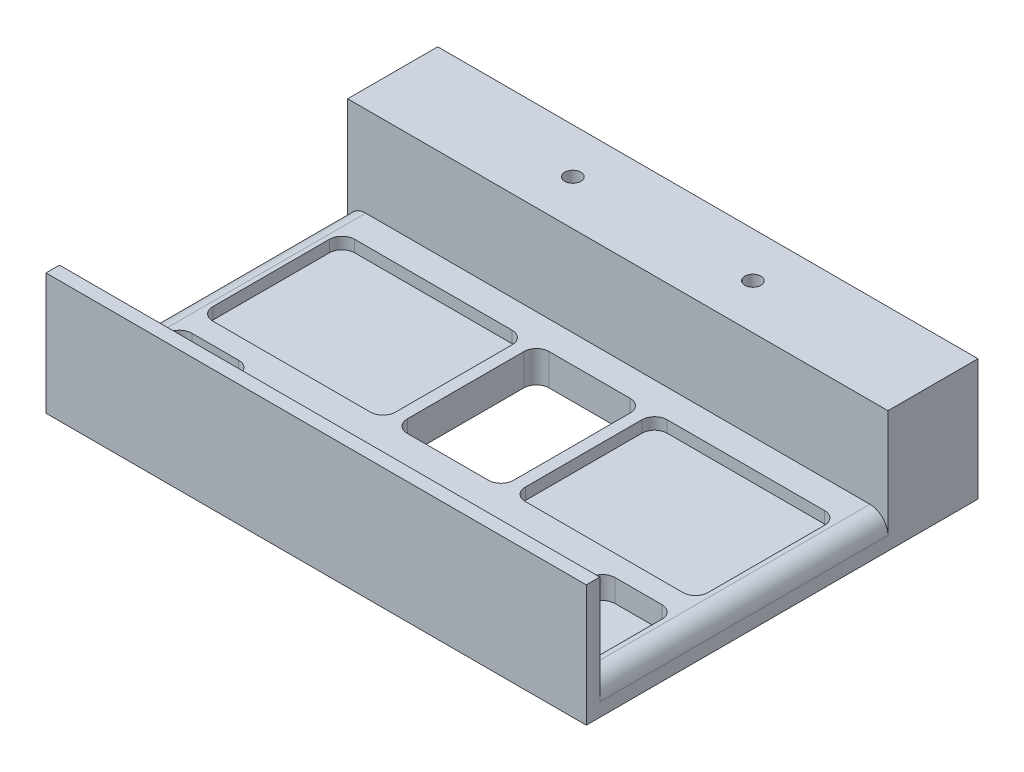
from build123d import *

# Parameters (mm, degrees)
SKETCH1_W                  = 76.2
SKETCH1_H                  = 44.45
BOSS_EXTRUDE1_DEPTH        = 4.445
SKETCH2_W                  = 76.2
SKETCH2_H                  = 1.905
BOSS_EXTRUDE2_DEPTH        = 12.7
CUT_EXTRUDE3_DEPTH         = 46.900442536
SKETCH7_W                  = 25.774
SKETCH7_H                  = 20
CUT_EXTRUDE4_DEPTH         = 1.651
SKETCH11_W                 = 10.16
SKETCH11_H                 = 12.192
CUT_EXTRUDE6_DEPTH         = 3.175
SKETCH13_W                 = 76.2
SKETCH13_H                 = 17.145
BOSS_EXTRUDE3_DEPTH        = 12.7
FILLET1_R                  = 1.778
F_10_32_TAPPED_HOLE1_D     = 4.0386
F_10_32_TAPPED_HOLE1_DEPTH = 6.35
F_10_32_TAPPED_HOLE1_TIP   = 1.213317848
F_4_40_TAPPED_HOLE1_D      = 2.2606
F_4_40_TAPPED_HOLE1_DEPTH  = 6.35
F_4_40_TAPPED_HOLE1_TIP    = 0.679152758
FILLET2_R                  = 2.54


with BuildPart() as part:
    # Sketch1 → Boss-Extrude1 (new body)
    with BuildSketch(Plane(origin=(0, 0, 0), x_dir=(1, 0, 0), z_dir=(0, 1, 0))):
        Rectangle(SKETCH1_W, SKETCH1_H)
    extrude(amount=BOSS_EXTRUDE1_DEPTH)

    # Sketch2 → Boss-Extrude2 (add)
    with BuildSketch(Plane(origin=(0, 4.445, 0), x_dir=(1, 0, 0), z_dir=(0, 1, 0))):
        with Locations((0, 21.2725)):
            Rectangle(SKETCH2_W, SKETCH2_H)
        with Locations((0, -21.2725)):
            Rectangle(SKETCH2_W, SKETCH2_H)
    extrude(amount=BOSS_EXTRUDE2_DEPTH)

    # Sketch6 → Cut-Extrude3 (cut, through all)
    with BuildSketch(Plane(origin=(0, 4.445, 0), x_dir=(1, 0, 0), z_dir=(0, 1, 0))):
        with BuildLine():
            Line((-7.5, 14.572), (-7.5, -1.872))
            ThreePointArc((-7.5, -1.872), (-6.979235857, -3.129235857), (-5.722, -3.65))
            Line((-5.722, -3.65), (5.722, -3.65))
            ThreePointArc((5.722, -3.65), (6.979235857, -3.129235857), (7.5, -1.872))
            Line((7.5, -1.872), (7.5, 14.572))
            ThreePointArc((7.5, 14.572), (6.979235857, 15.829235857), (5.722, 16.35))
            Line((5.722, 16.35), (-5.722, 16.35))
            ThreePointArc((-5.722, 16.35), (-6.979235857, 15.829235857), (-7.5, 14.572))
        make_face()
    extrude(amount=-CUT_EXTRUDE3_DEPTH, mode=Mode.SUBTRACT)

    # Sketch7 → Cut-Extrude4 (cut)
    with BuildSketch(Plane(origin=(0, 4.445, 0), x_dir=(1, 0, 0), z_dir=(0, 1, 0))):
        with Locations((-22.038, 6.35)):
            Rectangle(SKETCH7_W, SKETCH7_H)
        with Locations((22.038, 6.35)):
            Rectangle(SKETCH7_W, SKETCH7_H)
    extrude(amount=-CUT_EXTRUDE4_DEPTH, mode=Mode.SUBTRACT)

    # Sketch11 → Cut-Extrude6 (cut)
    with BuildSketch(Plane(origin=(0, 4.445, 0), x_dir=(1, 0, 0), z_dir=(0, 1, 0))):
        with Locations((-29.845, -12.7)):
            Rectangle(SKETCH11_W, SKETCH11_H)
        with Locations((29.845, -12.7)):
            Rectangle(SKETCH11_W, SKETCH11_H)
    extrude(amount=-CUT_EXTRUDE6_DEPTH, mode=Mode.SUBTRACT)

    # Sketch13 → Boss-Extrude3 (add)
    with BuildSketch(Plane.XY.offset(-20.32)):
        with Locations((0, 8.5725)):
            Rectangle(SKETCH13_W, SKETCH13_H)
    extrude(amount=-BOSS_EXTRUDE3_DEPTH)

    # Fillet1
    fillet1_edges = [part.edges().sort_by_distance(p)[0] for p in [
        (-34.925, 2.8575, 6.604),
        (-24.765, 2.8575, 6.604),
        (24.765, 2.8575, 18.796),
        (34.925, 2.8575, 18.796),
        (24.765, 2.8575, 6.604),
        (34.925, 2.8575, 6.604),
        (-34.925, 2.8575, 18.796),
        (-24.765, 2.8575, 18.796),
        (-9.151, 3.6195, 3.65),
        (-9.151, 3.6195, -16.35),
        (9.151, 3.6195, -16.35),
        (9.151, 3.6195, 3.65),
        (34.925, 3.6195, 3.65),
        (34.925, 3.6195, -16.35),
        (-34.925, 3.6195, 3.65),
        (-34.925, 3.6195, -16.35),
    ]]
    fillet(fillet1_edges, radius=FILLET1_R)

    # #10-32 Tapped Hole1
    with Locations(Plane(origin=(0, 0, -33.02), x_dir=(-1, 0, 0), z_dir=(0, 0, -1))):
        with Locations((-25.4, 8.89), (25.4, 8.89)):
            Hole(F_10_32_TAPPED_HOLE1_D / 2, depth=F_10_32_TAPPED_HOLE1_DEPTH)
            with Locations((0, 0, -(F_10_32_TAPPED_HOLE1_DEPTH + F_10_32_TAPPED_HOLE1_TIP / 2))):  # 118° drill point
                Cone(0, F_10_32_TAPPED_HOLE1_D / 2, F_10_32_TAPPED_HOLE1_TIP, mode=Mode.SUBTRACT)

    # #4-40 Tapped Hole1
    with Locations(Plane(origin=(0, 17.145, 0), x_dir=(-1, 0, 0), z_dir=(0, 1, 0))):
        with Locations((12.7, -26.67), (-12.7, -26.67)):
            Hole(F_4_40_TAPPED_HOLE1_D / 2, depth=F_4_40_TAPPED_HOLE1_DEPTH)
            with Locations((0, 0, -(F_4_40_TAPPED_HOLE1_DEPTH + F_4_40_TAPPED_HOLE1_TIP / 2))):  # 118° drill point
                Cone(0, F_4_40_TAPPED_HOLE1_D / 2, F_4_40_TAPPED_HOLE1_TIP, mode=Mode.SUBTRACT)

    # Fillet2
    fillet2_edges = [part.edges().sort_by_distance(p)[0] for p in [
        (38.1, 4.445, 0),
        (-38.1, 4.445, 0),
    ]]
    fillet(fillet2_edges, radius=FILLET2_R)


solid = part.part
